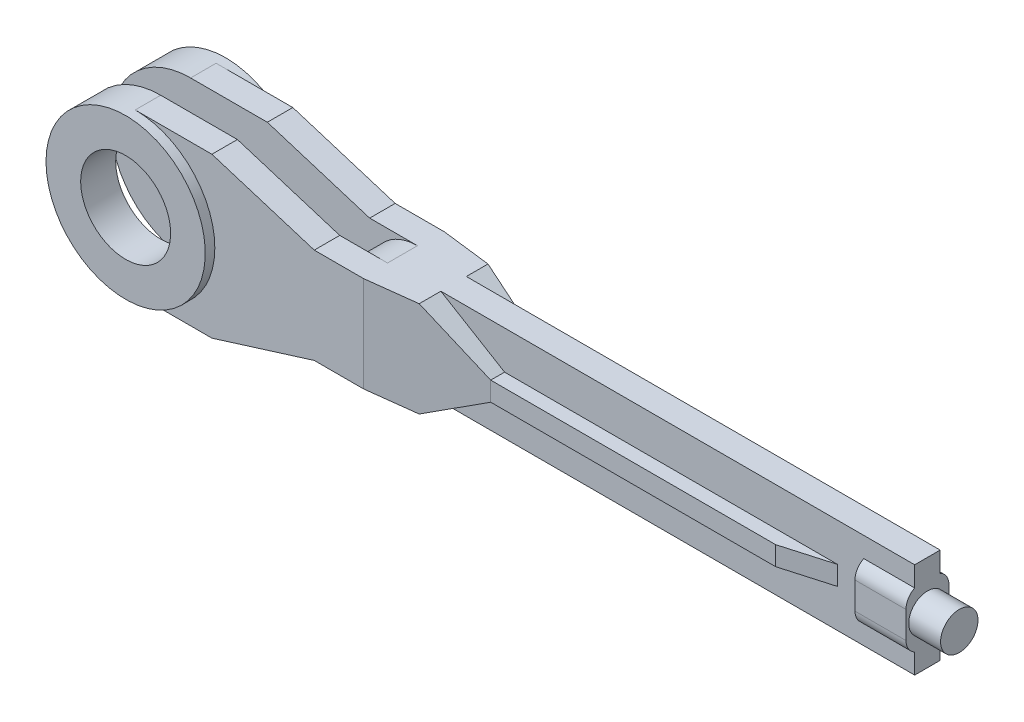
from build123d import *
from OCP.BRepFilletAPI import BRepFilletAPI_MakeChamfer
from build123d.topology import SkipClean

# Parameters (mm, degrees)
SKETCH1_R           = 7.0625
BOSS_EXTRUDE1_DEPTH = 4
SKETCH5_W           = 25.521905645
SKETCH5_H           = 15
BOSS_EXTRUDE2_DEPTH = 12.7
FILLET1_R           = 7.5
SKETCH6_W           = 64.371907972
SKETCH6_H           = 15
BOSS_EXTRUDE3_DEPTH = 2
CHAMFER1_SIZE       = 10
CHAMFER1_SIZE2      = 6
CHAMFER2_SIZE       = 6
CHAMFER2_SIZE2      = 10
SKETCH8_R           = 2.9375
BOSS_EXTRUDE4_DEPTH = 5
BOSS_EXTRUDE5_DEPTH = 1.5
CUT_EXTRUDE1_DEPTH  = 7.5
SKETCH11_W          = 6.742622272
SKETCH11_H          = 8.688704154
BOSS_EXTRUDE7_DEPTH = 8
FILLET2_R           = 2.5
SKETCH12_R          = 12.5
SKETCH12_R_2        = 7.0625
BOSS_EXTRUDE8_DEPTH = 1.5


# Some blends are built 0.0001 mm under size
with BuildPart() as part:
    # Sketch1 → Boss-Extrude1 (new body)
    with BuildSketch(Plane.XY):
        with BuildLine():
            Line((0, 12.5), (12.041321952, 12.5))
            Line((12.041321952, 12.5), (28.106186383, 7.5))
            Line((28.106186383, 7.5), (28.106186383, -7.5))
            Line((28.106186383, -7.5), (12.041321952, -12.5))
            Line((12.041321952, -12.5), (0, -12.5))
            ThreePointArc((0, -12.5), (-12.5, 0), (0, 12.5))
        make_face()
        Circle(SKETCH1_R, mode=Mode.SUBTRACT)
    boss_extrude1 = extrude(amount=BOSS_EXTRUDE1_DEPTH)

    # Sketch5 → Boss-Extrude2 (add)
    with BuildSketch(Plane.XY.offset(4)):
        with Locations((40.867139206, 0)):
            Rectangle(SKETCH5_W, SKETCH5_H)
    extrude(amount=-BOSS_EXTRUDE2_DEPTH)

    # Mirror1: Boss-Extrude1 across plane
    add(boss_extrude1.mirror(Plane(origin=(0, 0, -2.35), x_dir=(1, 0, 0), z_dir=(0, 0, -1))))

    # Fillet1
    fillet1_edges = [part.edges().sort_by_distance(p)[0] for p in [
        (28.106186383, -7.5, -2.35),
        (28.106186383, 7.5, -2.35),
    ]]
    fillet(fillet1_edges, radius=FILLET1_R - 0.0001)  # a hair under: the kernel refuses the full size

    # Sketch6 → Boss-Extrude3 (add, symmetric)
    with BuildSketch(Plane(origin=(0, 0, -2.35), x_dir=(-1, 0, 0), z_dir=(0, 0, -1))):
        with Locations((-85.814046014, 0)):
            Rectangle(SKETCH6_W, SKETCH6_H)
    extrude(amount=BOSS_EXTRUDE3_DEPTH, both=True)

    # Chamfer1
    chamfer1_edges = [part.edges().sort_by_distance(p)[0] for p in [
        (53.628092028, 7.5, -6.525),
        (53.628092028, 7.5, 1.825),
    ]]
    chamfer1_side = [part.faces().sort_by_distance(p)[0] for p in [
        (62.630754808, 7.5, -2.35),
    ]]
    chamfer(chamfer1_edges, length=CHAMFER1_SIZE, length2=CHAMFER1_SIZE2, reference=chamfer1_side[0])

    # Chamfer2: one chamfer whose edges measure the first distance from different faces: ONE call of the kernel's chamfer builder (chamfer() names one face for all edges)
    chamfer2_edges_1 = [part.edges().sort_by_distance(p)[0] for p in [
        (53.628092028, -7.5, -6.525),
    ]]
    chamfer2_side_1 = [part.faces().sort_by_distance(p)[0] for p in [
        (53.628092028, -3, -6.525),
    ]]
    chamfer2_edges_2 = [part.edges().sort_by_distance(p)[0] for p in [
        (53.628092028, -7.5, 1.825),
    ]]
    chamfer2_side_2 = [part.faces().sort_by_distance(p)[0] for p in [
        (53.628092028, -3, 1.825),
    ]]
    chamfer2 = BRepFilletAPI_MakeChamfer(part.part.solid().wrapped)
    for e in chamfer2_edges_1:
        chamfer2.Add(CHAMFER2_SIZE, CHAMFER2_SIZE2, e.wrapped, chamfer2_side_1[0].wrapped)  # the first distance lies on this face
    for e in chamfer2_edges_2:
        chamfer2.Add(CHAMFER2_SIZE, CHAMFER2_SIZE2, e.wrapped, chamfer2_side_2[0].wrapped)  # the first distance lies on this face
    add(Compound.cast(chamfer2.Shape()), mode=Mode.REPLACE)

    # Sketch8 → Boss-Extrude4 (add)
    with BuildSketch(Plane(origin=(118, 0, 0), x_dir=(0, 0, -1), z_dir=(1, 0, 0))):
        with Locations(Location((2.35, 0, 0), (0, 0, 132.910184022))):
            Circle(SKETCH8_R)
    extrude(amount=BOSS_EXTRUDE4_DEPTH)

    # Sketch9 → Boss-Extrude5 (add, symmetric)
    with BuildSketch(Plane(origin=(0, 0, 0), x_dir=(1, 0, 0), z_dir=(0, 1, 0))):
        Polygon((53.628092028, 6.525), (98.349917778, 6.525), (112.85605343, 2.35), (98.349917778, -1.825), (53.628092028, -1.825), align=None)
    extrude(amount=BOSS_EXTRUDE5_DEPTH, both=True)

    # Sketch10 → Cut-Extrude1 (cut, symmetric)
    with BuildSketch(Plane(origin=(0, 0, 0), x_dir=(1, 0, 0), z_dir=(0, 1, 0))):
        Polygon((53.628092028, 6.525), (35.842858925, 8.7), (53.628092028, 8.7), align=None)
        Polygon((53.628092028, -1.825), (35.842858925, -4), (53.628092028, -4), align=None)
    extrude(amount=CUT_EXTRUDE1_DEPTH, both=True, mode=Mode.SUBTRACT)

    # Sketch11 → Boss-Extrude7 (add)
    with BuildSketch(Plane.ZY.offset(-118)):
        with Locations((-2.35, 0)):
            Rectangle(SKETCH11_W, SKETCH11_H)
    extrude(amount=BOSS_EXTRUDE7_DEPTH)

    # Fillet2
    # the kernel refuses this fillet: 2.5 mm, written as the material it takes off along each edge
    with BuildSketch(Plane(origin=(123.576771831, 4.344352077, 1.021311136), x_dir=(0, -1, 0), z_dir=(-1, 0, 0)), Plane(origin=(123.576771831, -4.344352077, -5.721311136), x_dir=(0, 1, 0), z_dir=(-1, 0, 0))) as fillet2_piece_1:
        with BuildLine():
            CenterArc((2.230708732, -2.5), FILLET2_R, 90, 63.161607103)
            Line((0, -1.371311136), (-0.044614175, -1.348737359))
            ThreePointArc((-0.044614175, -1.348737359), (-0.05, -0.685655568), (-0.05, 0))
            Line((-0.05, 0), (0, 0.05))
            Line((0, 0.05), (2.230708732, 0.05))
            Line((2.230708732, 0.05), (2.230708732, 0))
        make_face()
    extrude(amount=19.153543662, mode=Mode.SUBTRACT)
    with BuildSketch(Plane(origin=(123.576771831, -4.344352077, 1.021311136), x_dir=(0, 0, -1), z_dir=(-1, 0, 0)), Plane(origin=(123.576771831, 4.344352077, -5.721311136), x_dir=(0, 0, 1), z_dir=(-1, 0, 0))) as fillet2_piece_2:
        with BuildLine():
            CenterArc((2.5, -2.230708732), FILLET2_R, 116.838392897, 63.161607103)
            Line((0, -2.230708732), (-0.05, -2.230708732))
            Line((-0.05, -2.230708732), (-0.05, 0))
            Line((-0.05, 0), (0, 0.05))
            ThreePointArc((0, 0.05), (0.685655568, 0.05), (1.348737359, 0.044614175))
            Line((1.348737359, 0.044614175), (1.371311136, 0))
        make_face()
    extrude(amount=19.153543662, mode=Mode.SUBTRACT)

    # Sketch12 → Boss-Extrude8 (add)
    with SkipClean():  # the faces are left unmerged after this step: merging them gives an invalid solid
        with BuildSketch(Plane(origin=(0, 0, -8.7), x_dir=(-1, 0, 0), z_dir=(0, 0, -1))):
            with Locations(Location((0, 0, 0), (0, 0, 90))):
                Circle(SKETCH12_R)
            with Locations(Location((0, 0, 0), (0, 0, 180))):
                Circle(SKETCH12_R_2, mode=Mode.SUBTRACT)
        boss_extrude8 = extrude(amount=BOSS_EXTRUDE8_DEPTH)

    # Mirror2: Boss-Extrude8 across plane
    with SkipClean():  # the faces are left unmerged after this step: merging them gives an invalid solid
        add(boss_extrude8.mirror(Plane(origin=(0, 0, -2.35), x_dir=(1, 0, 0), z_dir=(0, 0, -1))))


solid = part.part
